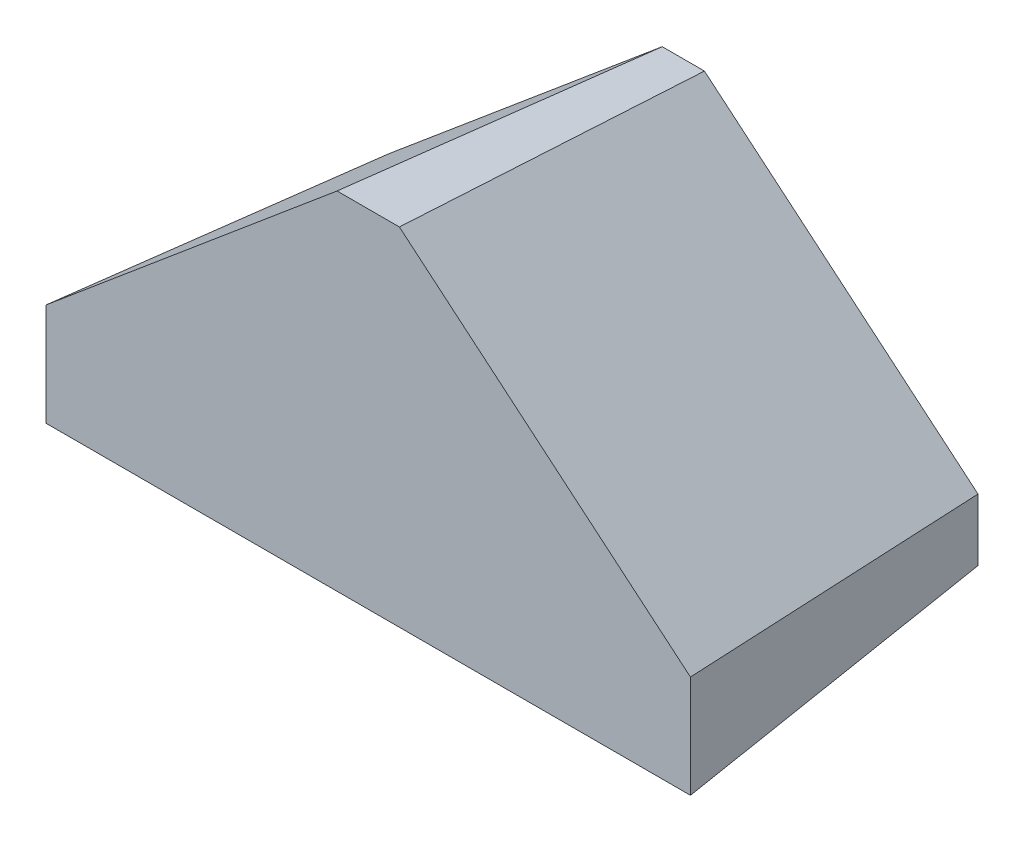
from build123d import *

# Parameters (mm, degrees)
SALIENTE_EXTRUIR3_DEPTH = 50.8
SALIENTE_EXTRUIR3_DRAFT = -5


with BuildPart() as part:
    # Croquis6 → Saliente-Extruir3 (with draft: the straight prism first)
    with BuildSketch(Plane.XY):
        Polygon((0, 0), (95, 0), (95, 10), (50.905117074, 47), (44.094882926, 47), (0, 10), align=None)
    extrude(amount=SALIENTE_EXTRUIR3_DEPTH)
    # Saliente-Extruir3: the draft: its side faces are tilted about the plane it starts from
    saliente_extruir3_sides = [part.faces().sort_by_distance(p)[0] for p in [
        (47.5, 0, 25.4),
        (95, 5, 25.4),
        (72.952558537, 28.5, 25.4),
        (47.5, 47, 25.4),
        (22.047441463, 28.5, 25.4),
        (0, 5, 25.4),
    ]]
    draft(saliente_extruir3_sides, Plane.XY, SALIENTE_EXTRUIR3_DRAFT)


solid = part.part
